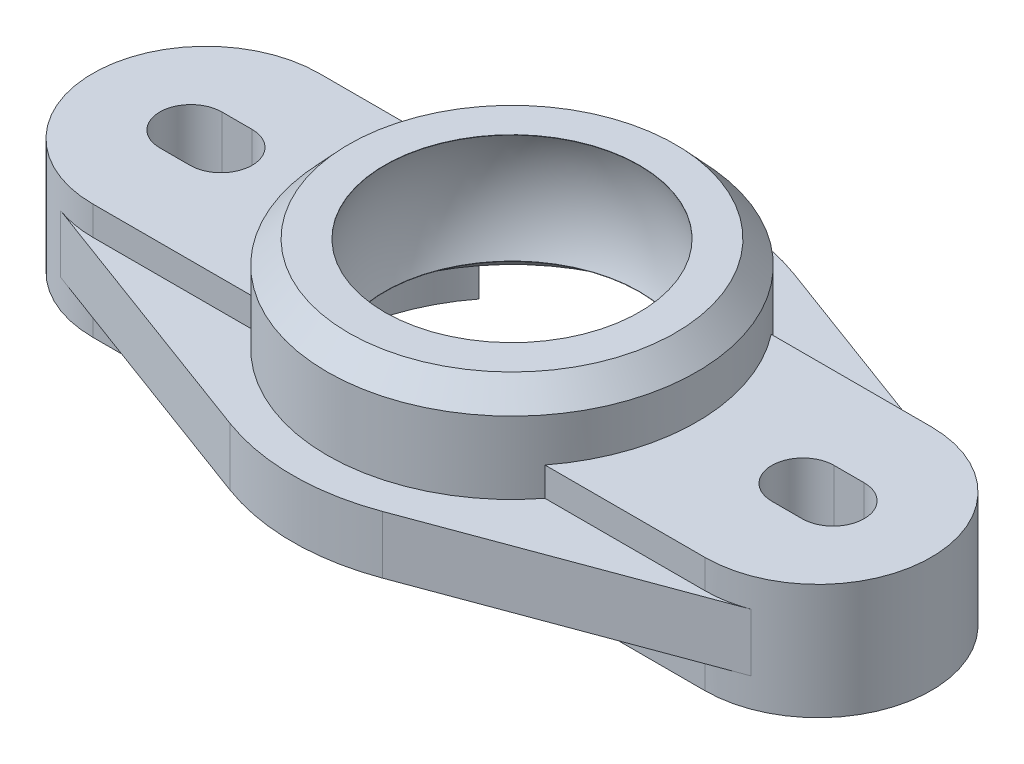
from build123d import *
from build123d.topology import SkipClean

# Parameters (mm, degrees)
BOSS_EXTRUDE1_DEPTH = 4.99999
BOSS_EXTRUDE2_DEPTH = 2.50063
SKETCH4_R           = 16.002
BOSS_EXTRUDE3_DEPTH = 8.24992
SKETCH5_R           = 11.030471831
CUT_EXTRUDE1_DEPTH  = 44.898126392
SKETCH6_R           = 15.99946
CUT_EXTRUDE2_DEPTH  = 2.49936
SKETCH8_R           = 12.53744
CUT_EXTRUDE3_DEPTH  = 3.75158
CHAMFER2_SIZE       = 1.99898
CHAMFER2_SIZE2      = 1.85674


with BuildPart() as part:
    # Sketch1 → Boss-Extrude1 (new, symmetric)
    with BuildSketch(Plane(origin=(0, 0, 0), x_dir=(1, 0, 0), z_dir=(0, 1, 0))):
        with BuildLine():
            Line((-26.5049, 9.79932), (26.5049, 9.79932))
            ThreePointArc((26.5049, 9.79932), (36.30422, 0), (26.5049, -9.79932))
            Line((26.5049, -9.79932), (-26.5049, -9.79932))
            ThreePointArc((-26.5049, -9.79932), (-36.30422, 0), (-26.5049, 9.79932))
        make_face()
        with BuildLine():
            Line((25.1968, 2.6924), (27.813, 2.6924))
            ThreePointArc((27.813, 2.6924), (30.5054, 0), (27.813, -2.6924))
            Line((27.813, -2.6924), (25.1968, -2.6924))
            ThreePointArc((25.1968, -2.6924), (22.5044, 0), (25.1968, 2.6924))
        make_face(mode=Mode.SUBTRACT)
        with BuildLine():
            Line((-27.813, 2.6924), (-25.1968, 2.6924))
            ThreePointArc((-25.1968, 2.6924), (-22.5044, 0), (-25.1968, -2.6924))
            Line((-25.1968, -2.6924), (-27.813, -2.6924))
            ThreePointArc((-27.813, -2.6924), (-30.5054, 0), (-27.813, 2.6924))
        make_face(mode=Mode.SUBTRACT)
    extrude(amount=BOSS_EXTRUDE1_DEPTH, both=True)

    # Sketch2 → Boss-Extrude2 (add, symmetric)
    with SkipClean():  # the faces are left unmerged after this step: merging them gives an invalid solid
        with BuildSketch(Plane(origin=(0, 0, 0), x_dir=(1, 0, 0), z_dir=(0, 1, 0))):
            with BuildLine():
                Line((-29.906254771, 9.190073894), (-6.594643258, 17.817976342))
                ThreePointArc((-6.594643258, 17.817976342), (0, 18.9992), (6.594643258, 17.817976342))
                Line((6.594643258, 17.817976342), (29.906254771, 9.190073894))
                ThreePointArc((29.906254771, 9.190073894), (36.30422, 0), (29.906254771, -9.190073894))
                Line((29.906254771, -9.190073894), (6.594643258, -17.817976342))
                ThreePointArc((6.594643258, -17.817976342), (0, -18.9992), (-6.594643258, -17.817976342))
                Line((-6.594643258, -17.817976342), (-29.906254771, -9.190073894))
                ThreePointArc((-29.906254771, -9.190073894), (-36.30422, 0), (-29.906254771, 9.190073894))
            make_face()
            with BuildLine():
                Line((-25.1968, 2.6924), (-27.813, 2.6924))
                ThreePointArc((-27.813, 2.6924), (-30.5054, 0), (-27.813, -2.6924))
                Line((-27.813, -2.6924), (-25.1968, -2.6924))
                ThreePointArc((-25.1968, -2.6924), (-22.5044, 0), (-25.1968, 2.6924))
            make_face(mode=Mode.SUBTRACT)
            with BuildLine():
                Line((27.813, 2.6924), (25.1968, 2.6924))
                ThreePointArc((25.1968, 2.6924), (22.5044, 0), (25.1968, -2.6924))
                Line((25.1968, -2.6924), (27.813, -2.6924))
                ThreePointArc((27.813, -2.6924), (30.5054, 0), (27.813, 2.6924))
            make_face(mode=Mode.SUBTRACT)
        extrude(amount=BOSS_EXTRUDE2_DEPTH, both=True)
    add(part.part.scale(1), mode=Mode.REPLACE)  # the faces are merged on a copy

    # Sketch4 → Boss-Extrude3 (add)
    with BuildSketch(Plane(origin=(0, 2.50063, 0), x_dir=(1, 0, 0), z_dir=(0, 1, 0))):
        with Locations(Location((0, 0, 0), (0, 0, 37.761861148))):
            Circle(SKETCH4_R)
    extrude(amount=BOSS_EXTRUDE3_DEPTH)

    # Sketch5 → Cut-Extrude1 (cut, through all)
    with BuildSketch(Plane(origin=(0, 10.75055, 0), x_dir=(1, 0, 0), z_dir=(0, 1, 0))):
        with Locations(Location((0, 0, 0), (0, 0, 270))):
            Circle(SKETCH5_R)
    extrude(amount=-CUT_EXTRUDE1_DEPTH, mode=Mode.SUBTRACT)

    # Sketch6 → Cut-Extrude2 (cut)
    with BuildSketch(Plane.XZ.offset(4.99999)):
        Circle(SKETCH6_R)
    extrude(amount=-CUT_EXTRUDE2_DEPTH, mode=Mode.SUBTRACT)

    # Sketch7 → Cut-Revolve1 (revolve, cut)
    with BuildSketch(Plane.XY, mode=Mode.PRIVATE) as cut_revolve1_sk:
        Polygon((12.647373159, -2.50063), (15.99946, -2.50063), (12.53744, 1.24841), (12.53744, -2.50063), align=None)
    revolve(cut_revolve1_sk.sketch.rotate(Axis((0, 2.50063, 0), (0, -1, 0)), 322.231092619), axis=Axis((0, 2.50063, 0), (0, -1, 0)), mode=Mode.SUBTRACT)

    # Sketch8 → Cut-Extrude3 (cut)
    with BuildSketch(Plane.XZ.offset(2.50063)):
        with Locations(Location((0, 0, 0), (0, 0, 270))):
            Circle(SKETCH8_R)
    extrude(amount=-CUT_EXTRUDE3_DEPTH, mode=Mode.SUBTRACT)

    # Chamfer2
    chamfer2_edges = [part.edges().sort_by_distance(p)[0] for p in [
        (-12.650586213, 10.75055, 9.79932),
    ]]
    chamfer2_side = [part.faces().sort_by_distance(p)[0] for p in [
        (-12.650586213, 6.62559, 9.79932),
    ]]
    chamfer(chamfer2_edges, length=CHAMFER2_SIZE, length2=CHAMFER2_SIZE2, reference=chamfer2_side[0])

    # Sketch9 → Cut-Revolve2 (revolve, cut)
    with BuildSketch(Plane(origin=(0, 6.00075, 0), x_dir=(1, 0, 0), z_dir=(0, 1, 0))):
        with BuildLine():
            Line((0, 12.00023), (0, -12.00023))
            ThreePointArc((0, -12.00023), (12.00023, 0), (0, 12.00023))
        make_face()
    revolve(axis=Axis((0, 6.00075, -22.182238591), (0, 0, 1)), mode=Mode.SUBTRACT)


solid = part.part
